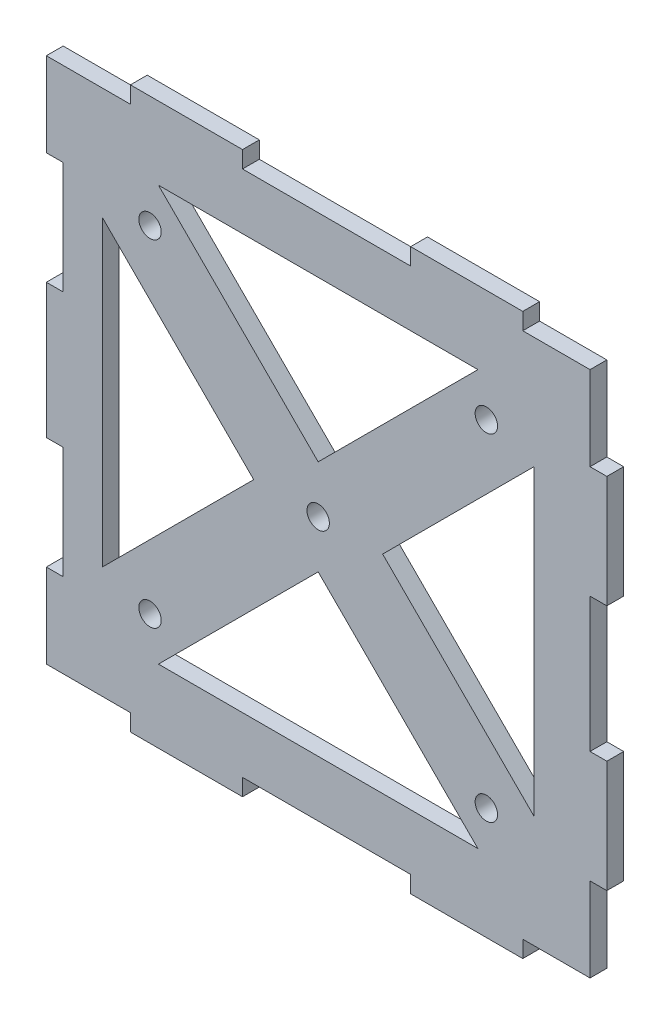
from build123d import *

# Parameters (mm, degrees)
ESQUISSE1_W             = 97
ESQUISSE1_H             = 94
ESQUISSE1_R             = 2
BOSS_EXTRU_1_DEPTH      = 3
ENL_V_MAT_EXTRU_1_REACH = 131.232
ESQUISSE2_W             = 3
ESQUISSE2_H             = 20
ESQUISSE3_W             = 20
ESQUISSE3_H             = 3
BOSS_EXTRU_2_DEPTH      = 3
ESQUISSE4_W             = 3
ESQUISSE4_H             = 20
BOSS_EXTRU_3_DEPTH      = 3
ESQUISSE5_W             = 20
ESQUISSE5_H             = 3
BOSS_EXTRU_4_DEPTH      = 3


with BuildPart() as part:
    # Esquisse1 → Boss.-Extru.1 (new body)
    with BuildSketch(Plane.XY):
        with Locations((-36.351443344, 50.427454033)):
            Rectangle(ESQUISSE1_W, ESQUISSE1_H)
        Polygon((-74.851443344, 23.427454033), (-74.851443344, 77.427454033), (-47.851443344, 50.427454033), align=None, mode=Mode.SUBTRACT)
        Polygon((-7.851443344, 13.427454033), (-64.851443344, 13.427454033), (-36.351443344, 41.927454033), align=None, mode=Mode.SUBTRACT)
        Polygon((2.148556656, 77.427454033), (2.148556656, 23.427454033), (-24.851443344, 50.427454033), align=None, mode=Mode.SUBTRACT)
        Polygon((-64.851443344, 87.427454033), (-7.851443344, 87.427454033), (-36.351443344, 58.927454033), align=None, mode=Mode.SUBTRACT)
        with Locations((-6.351443344, 80.427454033)):
            Circle(ESQUISSE1_R, mode=Mode.SUBTRACT)
        with Locations((-66.351443344, 20.427454033)):
            Circle(ESQUISSE1_R, mode=Mode.SUBTRACT)
        with Locations((-6.351443344, 20.427454033)):
            Circle(ESQUISSE1_R, mode=Mode.SUBTRACT)
        with Locations((-66.351443344, 80.427454033)):
            Circle(ESQUISSE1_R, mode=Mode.SUBTRACT)
        with Locations((-36.351443344, 50.427454033)):
            Circle(ESQUISSE1_R, mode=Mode.SUBTRACT)
    extrude(amount=BOSS_EXTRU_1_DEPTH)

    # Esquisse2 → Enlèv. mat.-Extru.1 (cut, up to next)
    with BuildSketch(Plane.XY.offset(3), mode=Mode.PRIVATE) as enl_v_mat_extru_1_sk1:
        with Locations((-83.351443344, 28.427454033)):
            Rectangle(ESQUISSE2_W, ESQUISSE2_H)
    enl_v_mat_extru_1_tool1 = extrude(enl_v_mat_extru_1_sk1.sketch, amount=-ENL_V_MAT_EXTRU_1_REACH, mode=Mode.PRIVATE) & part.part
    # Esquisse2 → Enlèv. mat.-Extru.1 (cut, up to next)
    with BuildSketch(Plane.XY.offset(3), mode=Mode.PRIVATE) as enl_v_mat_extru_1_sk2:
        with Locations((-83.351443344, 72.427454033)):
            Rectangle(ESQUISSE2_W, ESQUISSE2_H)
    enl_v_mat_extru_1_tool2 = extrude(enl_v_mat_extru_1_sk2.sketch, amount=-ENL_V_MAT_EXTRU_1_REACH, mode=Mode.PRIVATE) & part.part
    add(enl_v_mat_extru_1_tool1.solids().sort_by_distance((-83.351443, 28.427454, 3))[0], mode=Mode.SUBTRACT)
    add(enl_v_mat_extru_1_tool2.solids().sort_by_distance((-83.351443, 72.427454, 3))[0], mode=Mode.SUBTRACT)

    # Esquisse3 → Boss.-Extru.2 (add)
    with BuildSketch(Plane(origin=(0, 97.427454033, 0), x_dir=(1, 0, 0), z_dir=(0, 1, 0))):
        with Locations((-59.851443344, -1.5)):
            Rectangle(ESQUISSE3_W, ESQUISSE3_H)
        with Locations((-9.851443344, -1.5)):
            Rectangle(ESQUISSE3_W, ESQUISSE3_H)
    extrude(amount=BOSS_EXTRU_2_DEPTH)

    # Esquisse4 → Boss.-Extru.3 (add)
    with BuildSketch(Plane(origin=(12.148556656, 0, 0), x_dir=(0, 0, -1), z_dir=(1, 0, 0))):
        with Locations((-1.5, 72.427454033)):
            Rectangle(ESQUISSE4_W, ESQUISSE4_H)
        with Locations((-1.5, 28.427454033)):
            Rectangle(ESQUISSE4_W, ESQUISSE4_H)
    extrude(amount=BOSS_EXTRU_3_DEPTH)

    # Esquisse5 → Boss.-Extru.4 (add)
    with BuildSketch(Plane.XZ.offset(-3.427454033)):
        with Locations((-59.851443344, 1.5)):
            Rectangle(ESQUISSE5_W, ESQUISSE5_H)
        with Locations((-9.851443344, 1.5)):
            Rectangle(ESQUISSE5_W, ESQUISSE5_H)
    extrude(amount=BOSS_EXTRU_4_DEPTH)


solid = part.part
